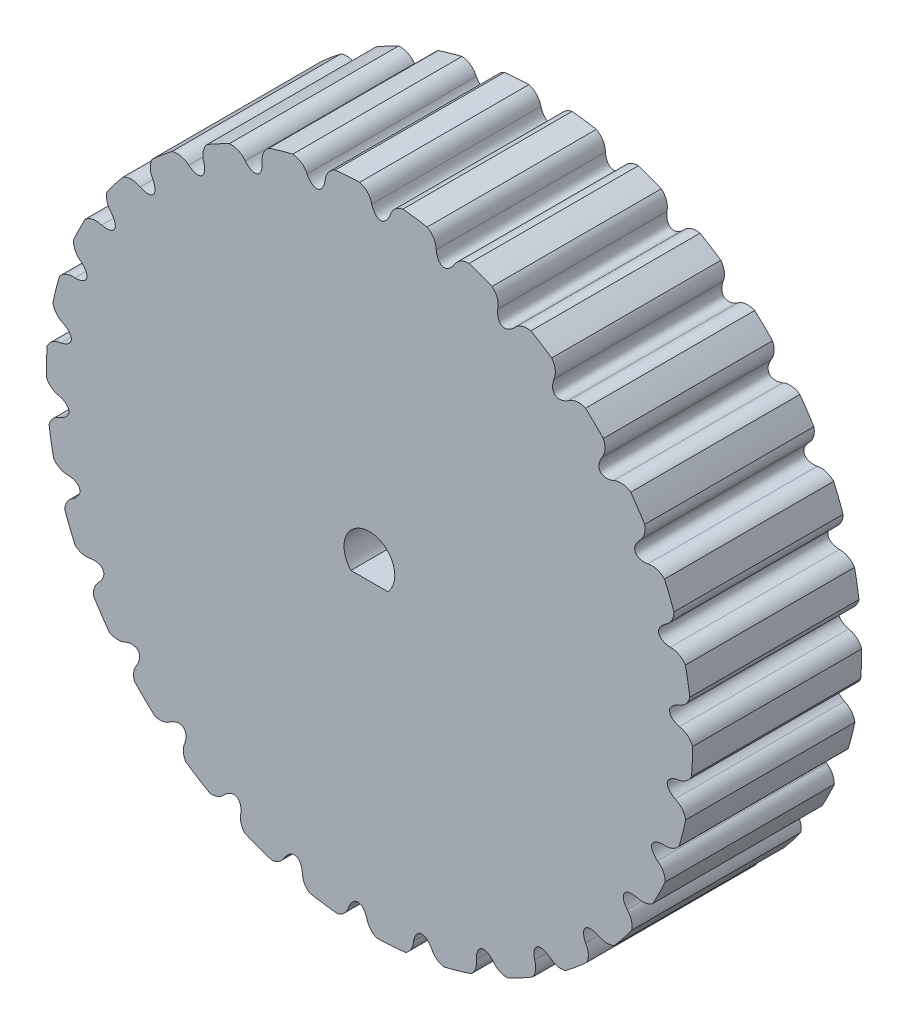
from build123d import *

# Parameters (mm, degrees)
SKETCH_1_R               = 28.647889755
EXTRUDE_1_DEPTH          = 15
CUT_EXTRUDE_3_DEPTH      = 15
PATTERN_CIRCULAR_1_DEPTH = 15
CUT_EXTRUDE_5_DEPTH      = 15


# Read off the part's stored shape, not the designer's step: Круговой массив1
with BuildPart() as part:
    # Эскиз1 → Бобышка-Вытянуть1 (new body)
    with BuildSketch(Plane.XY):
        Circle(SKETCH_1_R)
    extrude(amount=EXTRUDE_1_DEPTH)

    # Эскиз2 → Вырез-Вытянуть3 (cut)
    with BuildSketch(Plane.XY.offset(15)):
        with BuildLine():
            Line((4.783265488, 28.313897399), (4.555060767, 28.370295608))
            Line((4.555060767, 28.370295608), (7.420191225, 29.5242539))
            Line((7.420191225, 29.5242539), (9.194548177, 27.20324794))
            ThreePointArc((9.194548177, 27.20324794), (8.209649641, 27.119585332), (7.490641127, 26.441314505))
            add(Edge.make_bspline(
                [(5.923227103, 26.83594973), (6.165415766, 24.487827022), (7.490641127, 26.441314505)],
                knots=[5.342155302, 5.342155302, 5.342155302, 7.224215313, 7.224215313, 7.224215313], degree=2, weights=[1, 0.588955923, 1]))
            ThreePointArc((5.923227103, 26.83594973), (5.611124163, 27.773828354), (4.783265488, 28.313897399))
        make_face()
    extrude(amount=-CUT_EXTRUDE_3_DEPTH, mode=Mode.SUBTRACT)

    # Круговой массив1 outline → Круговой массив1 (cut)
    with BuildSketch(Plane.XY):
        with BuildLine():
            ThreePointArc((-0.857374536, 28.635057121), (-0.162957427, 28.208698815), (0.206087934, 27.482198954))
            add(Edge.make_bspline(
                [(0.206087934, 27.482198954), (0.931186357, 25.235742215), (1.821299478, 27.422071155)],
                knots=[5.342155302, 5.342155302, 5.342155302, 7.224215313, 7.224215313, 7.224215313], degree=2, weights=[1, 0.588955923, 1]))
            ThreePointArc((1.821299478, 27.422071155), (2.244682428, 28.120376446), (2.971136581, 28.493401602))
            ThreePointArc((2.971136581, 28.493401602), (1.059251654, 28.628300218), (-0.857374536, 28.635057121))
        make_face()
        with BuildLine():
            ThreePointArc((12.832183285, 24.303267333), (13.501250761, 24.768396637), (14.314771432, 24.815094323))
            ThreePointArc((14.314771432, 24.815094323), (12.623452266, 25.716726859), (10.875629889, 26.503250026))
            ThreePointArc((10.875629889, 26.503250026), (11.338834392, 25.830698896), (11.381070295, 25.015162532))
            add(Edge.make_bspline(
                [(11.381070295, 25.015162532), (11.129764393, 22.667998084), (12.832183285, 24.303267333)],
                knots=[5.342155302, 5.342155302, 5.342155302, 7.224215313, 7.224215313, 7.224215313], degree=2, weights=[1, 0.588955923, 1]))
        make_face()
        with BuildLine():
            ThreePointArc((17.612474929, 21.10137256), (18.358599847, 21.416600687), (19.159842369, 21.297934825))
            ThreePointArc((19.159842369, 21.297934825), (17.699326857, 22.526327181), (16.160266483, 23.654753743))
            ThreePointArc((16.160266483, 23.654753743), (16.469724734, 22.902549902), (16.341083574, 22.099414496))
            add(Edge.make_bspline(
                [(16.341083574, 22.099414496), (15.60726638, 19.855790658), (17.612474929, 21.10137256)],
                knots=[5.342155302, 5.342155302, 5.342155302, 7.224215313, 7.224215313, 7.224215313], degree=2, weights=[1, 0.588955923, 1]))
        make_face()
        with BuildLine():
            ThreePointArc((21.622594375, 16.975568352), (22.410584503, 17.129375348), (23.165022955, 16.854770805))
            ThreePointArc((23.165022955, 16.854770805), (21.999775921, 18.349698823), (20.738225155, 19.764301275))
            ThreePointArc((20.738225155, 19.764301275), (20.878729366, 18.969013093), (20.586490558, 18.216137803))
            add(Edge.make_bspline(
                [(20.586490558, 18.216137803), (19.402233404, 16.174111702), (21.622594375, 16.975568352)],
                knots=[5.342155302, 5.342155302, 5.342155302, 7.224215313, 7.224215313, 7.224215313], degree=2, weights=[1, 0.588955923, 1]))
        make_face()
        with BuildLine():
            ThreePointArc((24.687280161, 12.10617215), (25.481178928, 12.09537403), (26.158350936, 11.680850301))
            ThreePointArc((26.158350936, 11.680850301), (25.336556291, 13.370134734), (24.405814099, 15.001927399))
            ThreePointArc((24.405814099, 15.001927399), (24.37163839, 14.202928876), (23.931746591, 13.535050278))
            add(Edge.make_bspline(
                [(23.931746591, 13.535050278), (22.348807198, 11.783868255), (24.687280161, 12.10617215)],
                knots=[5.342155302, 5.342155302, 5.342155302, 7.224215313, 7.224215313, 7.224215313], degree=2, weights=[1, 0.588955923, 1]))
        make_face()
        with BuildLine():
            ThreePointArc((26.672590812, 6.705999934), (27.437627943, 6.535289378), (28.012098975, 6.001991207))
            ThreePointArc((28.012098975, 6.001991207), (27.563858837, 7.80610489), (26.999554978, 9.577349243))
            ThreePointArc((26.999554978, 9.577349243), (26.794860301, 8.814063586), (26.230647931, 8.260737909))
            add(Edge.make_bspline(
                [(26.230647931, 8.260737909), (24.318208346, 6.87693502), (26.672590812, 6.705999934)],
                knots=[5.342155302, 5.342155302, 5.342155302, 7.224215313, 7.224215313, 7.224215313], degree=2, weights=[1, 0.588955923, 1]))
        make_face()
        with BuildLine():
            ThreePointArc((27.491758726, 1.011065144), (28.195948874, 0.692147013), (28.647816187, 0.06492419))
            ThreePointArc((28.647816187, 0.06492419), (28.584709819, 1.901565692), (28.403975718, 3.730382142))
            ThreePointArc((28.403975718, 3.730382142), (28.042285924, 3.039605739), (27.382721558, 2.623713456))
            add(Edge.make_bspline(
                [(27.382721558, 2.623713456), (25.224364568, 1.667768528), (27.491758726, 1.011065144)],
                knots=[5.342155302, 5.342155302, 5.342155302, 7.224215313, 7.224215313, 7.224215313], degree=2, weights=[1, 0.588955923, 1]))
        make_face()
        with BuildLine():
            ThreePointArc((27.108982334, -4.729736244), (27.724336798, -5.179251287), (28.039400855, -5.873124137))
            ThreePointArc((28.039400855, -5.873124137), (28.355168104, -4.084853649), (28.557002858, -2.280170013))
            ThreePointArc((28.557002858, -2.280170013), (28.059905537, -2.866538418), (27.337616327, -3.129658065))
            add(Edge.make_bspline(
                [(27.337616327, -3.129658065), (25.02767249, -3.615965652), (27.108982334, -4.729736244)],
                knots=[5.342155302, 5.342155302, 5.342155302, 7.224215313, 7.224215313, 7.224215313], degree=2, weights=[1, 0.588955923, 1]))
        make_face()
        with BuildLine():
            ThreePointArc((25.540990802, -10.265503661), (26.044359734, -10.823314562), (26.21407603, -11.55525012))
            ThreePointArc((26.21407603, -11.55525012), (26.886134897, -9.891275845), (27.452691243, -8.188487715))
            ThreePointArc((27.452691243, -8.188487715), (26.848014351, -8.645109932), (26.097303553, -8.747926709))
            add(Edge.make_bspline(
                [(26.097303553, -8.747926709), (23.736728498, -8.743342979), (25.540990802, -10.265503661)],
                knots=[5.342155302, 5.342155302, 5.342155302, 7.224215313, 7.224215313, 7.224215313], degree=2, weights=[1, 0.588955923, 1]))
        make_face()
        with BuildLine():
            ThreePointArc((22.856312883, -15.354297507), (23.229903283, -15.994639434), (23.251200211, -16.735688697))
            ThreePointArc((23.251200211, -16.735688697), (24.242719206, -15.264080485), (25.141227491, -13.733909413))
            ThreePointArc((25.141227491, -13.733909413), (24.4609655, -14.042989432), (23.715990856, -13.985547177))
            add(Edge.make_bspline(
                [(23.715990856, -13.985547177), (21.40795304, -13.490272462), (22.856312883, -15.354297507)],
                knots=[5.342155302, 5.342155302, 5.342155302, 7.224215313, 7.224215313, 7.224215313], degree=2, weights=[1, 0.588955923, 1]))
        make_face()
        with BuildLine():
            ThreePointArc((19.172281885, -19.773713073), (19.403909174, -20.468529373), (19.278931886, -21.190195203))
            ThreePointArc((19.278931886, -21.190195203), (20.541221205, -19.968971404), (21.726302463, -18.672690454))
            ThreePointArc((21.726302463, -18.672690454), (21.004535693, -18.824307162), (20.297753027, -18.613610323))
            add(Edge.make_bspline(
                [(20.297753027, -18.613610323), (18.143124779, -17.649290504), (19.172281885, -19.773713073)],
                knots=[5.342155302, 5.342155302, 5.342155302, 7.224215313, 7.224215313, 7.224215313], degree=2, weights=[1, 0.588955923, 1]))
        make_face()
        with BuildLine():
            ThreePointArc((14.64990764, -23.330600692), (14.733041941, -24.050621812), (14.468861342, -24.725566503))
            ThreePointArc((14.468861342, -24.725566503), (15.943901436, -23.801125908), (17.360070751, -22.788802755))
            ThreePointArc((17.360070751, -22.788802755), (16.631062948, -22.780697238), (15.991983462, -22.429847578))
            add(Edge.make_bspline(
                [(15.991983462, -22.429847578), (14.084932375, -21.038628059), (14.64990764, -23.330600692)],
                knots=[5.342155302, 5.342155302, 5.342155302, 7.224215313, 7.224215313, 7.224215313], degree=2, weights=[1, 0.588955923, 1]))
        make_face()
        with BuildLine():
            ThreePointArc((9.486839604, -25.869507306), (9.420504762, -26.585221903), (9.028813367, -27.187903865))
            ThreePointArc((9.028813367, -27.187903865), (10.651794196, -26.5940006), (12.236009839, -25.903313509))
            ThreePointArc((12.236009839, -25.903313509), (11.532600684, -25.740271022), (10.986864952, -25.267471063))
            add(Edge.make_bspline(
                [(10.986864952, -25.267471063), (9.410738309, -23.510154811), (9.486839604, -25.869507306)],
                knots=[5.342155302, 5.342155302, 5.342155302, 7.224215313, 7.224215313, 7.224215313], degree=2, weights=[1, 0.588955923, 1]))
        make_face()
        with BuildLine():
            ThreePointArc((3.908728626, -27.279470515), (3.697303481, -27.961993732), (3.194103602, -28.469269214))
            ThreePointArc((3.194103602, -28.469269214), (4.895897395, -28.22643754), (6.580062715, -27.881971992))
            ThreePointArc((6.580062715, -27.881971992), (5.932406683, -27.57494603), (5.501145194, -27.002463014))
            add(Edge.make_bspline(
                [(5.501145194, -27.002463014), (4.324827293, -24.955853184), (3.908728626, -27.279470515)],
                knots=[5.342155302, 5.342155302, 5.342155302, 7.224215313, 7.224215313, 7.224215313], degree=2, weights=[1, 0.588955923, 1]))
        make_face()
        with BuildLine():
            ThreePointArc((-1.840635079, -27.498868159), (-2.187677095, -28.120727086), (-2.78240365, -28.512450216))
            ThreePointArc((-2.78240365, -28.512450216), (-1.072871909, -28.627793022), (0.640497695, -28.640728869))
            ThreePointArc((0.640497695, -28.640728869), (0.075146707, -28.205840177), (-0.225423536, -27.558995958))
            add(Edge.make_bspline(
                [(-0.225423536, -27.558995958), (-0.950521958, -25.312539219), (-1.840635079, -27.498868159)],
                knots=[5.342155302, 5.342155302, 5.342155302, 7.224215313, 7.224215313, 7.224215313], degree=2, weights=[1, 0.588955923, 1]))
        make_face()
        with BuildLine():
            ThreePointArc((-7.509976728, -26.518111509), (-7.978370842, -27.053976967), (-8.641038475, -27.313623734))
            ThreePointArc((-8.641038475, -27.313623734), (-6.9945273, -27.780895869), (-5.323050455, -28.149009242))
            ThreePointArc((-5.323050455, -28.149009242), (-5.783761563, -27.606524107), (-5.942562704, -26.912746734))
            add(Edge.make_bspline(
                [(-5.942562704, -26.912746734), (-6.184751368, -24.564624026), (-7.509976728, -26.518111509)],
                knots=[5.342155302, 5.342155302, 5.342155302, 7.224215313, 7.224215313, 7.224215313], degree=2, weights=[1, 0.588955923, 1]))
        make_face()
        with BuildLine():
            ThreePointArc((-12.851518886, -24.380064337), (-13.422555546, -24.80745996), (-14.126437165, -24.922787975))
            ThreePointArc((-14.126437165, -24.922787975), (-12.611215775, -25.722729717), (-11.050881714, -26.430656457))
            ThreePointArc((-11.050881714, -26.430656457), (-11.38920951, -25.804013831), (-11.400405897, -25.091959536))
            add(Edge.make_bspline(
                [(-11.400405897, -25.091959536), (-11.149099994, -22.744795088), (-12.851518886, -24.380064337)],
                knots=[5.342155302, 5.342155302, 5.342155302, 7.224215313, 7.224215313, 7.224215313], degree=2, weights=[1, 0.588955923, 1]))
        make_face()
        with BuildLine():
            ThreePointArc((-17.63181053, -21.178169564), (-18.28274456, -21.478183093), (-18.998571432, -21.441918547))
            ThreePointArc((-18.998571432, -21.441918547), (-17.678313507, -22.542821894), (-16.294401948, -23.562556155))
            ThreePointArc((-16.294401948, -23.562556155), (-16.49739744, -22.877478541), (-16.360419175, -22.1762115))
            add(Edge.make_bspline(
                [(-16.360419175, -22.1762115), (-15.626601981, -19.932587662), (-17.63181053, -21.178169564)],
                knots=[5.342155302, 5.342155302, 5.342155302, 7.224215313, 7.224215313, 7.224215313], degree=2, weights=[1, 0.588955923, 1]))
        make_face()
        with BuildLine():
            ThreePointArc((-21.641929976, -17.052365356), (-22.346487111, -17.210373169), (-23.043239243, -17.020890476))
            ThreePointArc((-23.043239243, -17.020890476), (-21.974961644, -18.379408264), (-20.826710345, -19.671037684))
            ThreePointArc((-20.826710345, -19.671037684), (-20.886313744, -18.954731126), (-20.60582616, -18.292934807))
            add(Edge.make_bspline(
                [(-20.60582616, -18.292934807), (-19.421569006, -16.250908707), (-21.641929976, -17.052365356)],
                knots=[5.342155302, 5.342155302, 5.342155302, 7.224215313, 7.224215313, 7.224215313], degree=2, weights=[1, 0.588955923, 1]))
        make_face()
        with BuildLine():
            ThreePointArc((-24.706615762, -12.182969154), (-25.435640514, -12.189364753), (-26.081571728, -11.851295441))
            ThreePointArc((-26.081571728, -11.851295441), (-25.313610369, -13.413527406), (-24.452181812, -14.926231675))
            ThreePointArc((-24.452181812, -14.926231675), (-24.365257967, -14.206658253), (-23.951082192, -13.611847282))
            add(Edge.make_bspline(
                [(-23.951082192, -13.611847282), (-22.368142799, -11.860665259), (-24.706615762, -12.182969154)],
                knots=[5.342155302, 5.342155302, 5.342155302, 7.224215313, 7.224215313, 7.224215313], degree=2, weights=[1, 0.588955923, 1]))
        make_face()
        with BuildLine():
            ThreePointArc((-26.691926413, -6.782796938), (-27.414215692, -6.633689604), (-27.9781356, -6.158369568))
            ThreePointArc((-27.9781356, -6.158369568), (-27.548174286, -7.861277305), (-27.014667971, -9.534636951))
            ThreePointArc((-27.014667971, -9.534636951), (-26.783013157, -8.839829882), (-26.249983532, -8.337534914))
            add(Edge.make_bspline(
                [(-26.249983532, -8.337534914), (-24.337543947, -6.953732025), (-26.691926413, -6.782796938)],
                knots=[5.342155302, 5.342155302, 5.342155302, 7.224215313, 7.224215313, 7.224215313], degree=2, weights=[1, 0.588955923, 1]))
        make_face()
        with BuildLine():
            ThreePointArc((-27.511094327, -1.087862148), (-28.194451259, -0.785686653), (-28.647250829, -0.191330468))
            ThreePointArc((-28.647250829, -0.191330468), (-28.580450721, -1.964541662), (-28.403997586, -3.730215608))
            ThreePointArc((-28.403997586, -3.730215608), (-28.034329199, -3.087601599), (-27.402057159, -2.70051046))
            add(Edge.make_bspline(
                [(-27.402057159, -2.70051046), (-25.243700169, -1.744565532), (-27.511094327, -1.087862148)],
                knots=[5.342155302, 5.342155302, 5.342155302, 7.224215313, 7.224215313, 7.224215313], degree=2, weights=[1, 0.588955923, 1]))
        make_face()
        with BuildLine():
            ThreePointArc((-27.128317935, 4.65293924), (-27.740839365, 5.098983378), (-28.057199417, 5.787499312))
            ThreePointArc((-28.057199417, 5.787499312), (-28.364514485, 4.019440926), (-28.560525818, 2.235610059))
            ThreePointArc((-28.560525818, 2.235610059), (-28.064448769, 2.799915602), (-27.356951928, 3.052861061))
            add(Edge.make_bspline(
                [(-27.356951928, 3.052861061), (-25.047008091, 3.539168647), (-27.128317935, 4.65293924)],
                knots=[5.342155302, 5.342155302, 5.342155302, 7.224215313, 7.224215313, 7.224215313], degree=2, weights=[1, 0.588955923, 1]))
        make_face()
        with BuildLine():
            ThreePointArc((-25.560326403, 10.188706657), (-26.071906236, 10.762483272), (-26.232073769, 11.514334249))
            ThreePointArc((-26.232073769, 11.514334249), (-26.908877838, 9.829236027), (-27.477560699, 8.104643446))
            ThreePointArc((-27.477560699, 8.104643446), (-26.871488669, 8.566597426), (-26.116639154, 8.671129705))
            add(Edge.make_bspline(
                [(-26.116639154, 8.671129705), (-23.756064099, 8.666545975), (-25.560326403, 10.188706657)],
                knots=[5.342155302, 5.342155302, 5.342155302, 7.224215313, 7.224215313, 7.224215313], degree=2, weights=[1, 0.588955923, 1]))
        make_face()
        with BuildLine():
            ThreePointArc((-22.875648484, 15.277500503), (-23.259639027, 15.956133457), (-23.251102266, 16.735824773))
            ThreePointArc((-23.251102266, 16.735824773), (-24.276291668, 15.210629513), (-25.201582745, 13.622841645))
            ThreePointArc((-25.201582745, 13.622841645), (-24.506578542, 13.961311127), (-23.735326457, 13.908750173))
            add(Edge.make_bspline(
                [(-23.735326457, 13.908750173), (-21.427288642, 13.413475458), (-22.875648484, 15.277500503)],
                knots=[5.342155302, 5.342155302, 5.342155302, 7.224215313, 7.224215313, 7.224215313], degree=2, weights=[1, 0.588955923, 1]))
        make_face()
        with BuildLine():
            ThreePointArc((-19.191617486, 19.696916069), (-19.426545128, 20.451444923), (-19.245395299, 21.220658501))
            ThreePointArc((-19.245395299, 21.220658501), (-20.581161725, 19.927803928), (-21.830266635, 18.551038947))
            ThreePointArc((-21.830266635, 18.551038947), (-21.071752285, 18.748725017), (-20.317088628, 18.536813319))
            add(Edge.make_bspline(
                [(-20.317088628, 18.536813319), (-18.16246038, 17.5724935), (-19.191617486, 19.696916069)],
                knots=[5.342155302, 5.342155302, 5.342155302, 7.224215313, 7.224215313, 7.224215313], degree=2, weights=[1, 0.588955923, 1]))
        make_face()
        with BuildLine():
            ThreePointArc((-14.669243241, 23.253803687), (-14.740427771, 24.050358316), (-14.392177641, 24.770280785))
            ThreePointArc((-14.392177641, 24.770280785), (-15.98465954, 23.773772245), (-17.508407188, 22.675036165))
            ThreePointArc((-17.508407188, 22.675036165), (-16.715679725, 22.719476303), (-16.011319063, 22.353050574))
            add(Edge.make_bspline(
                [(-16.011319063, 22.353050574), (-14.104267976, 20.961831054), (-14.669243241, 23.253803687)],
                knots=[5.342155302, 5.342155302, 5.342155302, 7.224215313, 7.224215313, 7.224215313], degree=2, weights=[1, 0.588955923, 1]))
        make_face()
        with BuildLine():
            ThreePointArc((-9.506175206, 25.792710302), (-9.407061789, 26.594209629), (-8.906714626, 27.228147605))
            ThreePointArc((-8.906714626, 27.228147605), (-10.687718473, 26.579583541), (-12.421936978, 25.814667712))
            ThreePointArc((-12.421936978, 25.814667712), (-11.627411248, 25.699282187), (-11.006200554, 25.190674058))
            add(Edge.make_bspline(
                [(-11.006200554, 25.190674058), (-9.430073911, 23.433357807), (-9.506175206, 25.792710302)],
                knots=[5.342155302, 5.342155302, 5.342155302, 7.224215313, 7.224215313, 7.224215313], degree=2, weights=[1, 0.588955923, 1]))
        make_face()
        with BuildLine():
            ThreePointArc((-3.928064227, 27.20267351), (-3.661058057, 27.970972068), (-3.032301922, 28.486957234))
            ThreePointArc((-3.032301922, 28.486957234), (-4.922216324, 28.221859858), (-6.790287254, 27.831521453))
            ThreePointArc((-6.790287254, 27.831521453), (-6.028379538, 27.556625578), (-5.520480796, 26.92566601))
            add(Edge.make_bspline(
                [(-5.520480796, 26.92566601), (-4.344162894, 24.879056179), (-3.928064227, 27.20267351)],
                knots=[5.342155302, 5.342155302, 5.342155302, 7.224215313, 7.224215313, 7.224215313], degree=2, weights=[1, 0.588955923, 1]))
        make_face()
    extrude(amount=PATTERN_CIRCULAR_1_DEPTH, mode=Mode.SUBTRACT)

    # Эскиз3 → Вырез-Вытянуть5 (cut)
    with BuildSketch(Plane.XY.offset(15)):
        with BuildLine():
            Line((-1.630950643, -1.55), (1.630950643, -1.55))
            ThreePointArc((1.630950643, -1.55), (0, 2.25), (-1.630950643, -1.55))
        make_face()
    extrude(amount=-CUT_EXTRUDE_5_DEPTH, mode=Mode.SUBTRACT)


solid = part.part
